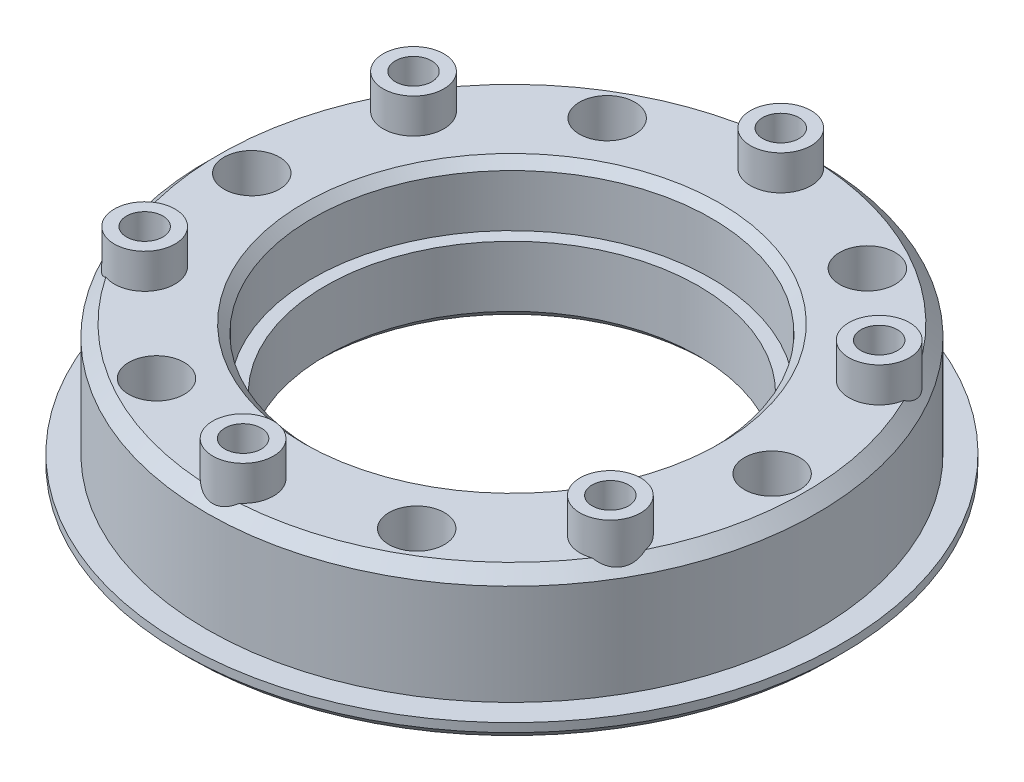
from build123d import *

# Parameters (mm, degrees)
SKETCH1_R                    = 19
BOSS_EXTRUDE1_DEPTH          = 1
SKETCH2_R                    = 17.575
BOSS_EXTRUDE2_DEPTH          = 6.5
SKETCH4_R                    = 10.75
CUT_EXTRUDE1_DEPTH           = 7.5
SKETCH5_R                    = 1.05
CUT_EXTRUDE2_DEPTH           = 3
CIRPATTERN1_COUNT            = 6
SKETCH6_R                    = 1.6
CUT_EXTRUDE3_DEPTH           = 7.5
CIRPATTERN2_COUNT            = 6
SKETCH7_R                    = 11.5
CUT_EXTRUDE4_DEPTH           = 3.5
CHAMFER1_SIZE                = 0.5
BOSS_EXTRUDE3_START          = 2
SKETCH8_R                    = 1.75
SKETCH8_R_2                  = 1.05
BOSS_EXTRUDE3_DEPTH          = 2
CIRPATTERN3_COUNT            = 6
CHAMFER2_SIZE                = 0.7
CUT_EXTRUDE5_DEPTH           = 3
FILLET1_R                    = 1
CHAMFER3_SIZE                = 0.5
CIRPATTERN4_COUNT            = 6
FILLET1_OF_CIRPATTERN4_R     = 1
CHAMFER3_OF_CIRPATTERN4_SIZE = 0.5


with BuildPart() as part:
    # Sketch1 → Boss-Extrude1 (new body)
    with BuildSketch(Plane(origin=(0, 0, 0), x_dir=(1, 0, 0), z_dir=(0, 1, 0))):
        with Locations(Location((0, 0, 0), (0, 0, 270))):
            Circle(SKETCH1_R)
    extrude(amount=BOSS_EXTRUDE1_DEPTH)

    # Sketch2 → Boss-Extrude2 (add)
    with BuildSketch(Plane(origin=(0, 1, 0), x_dir=(1, 0, 0), z_dir=(0, 1, 0))):
        with Locations(Location((0, 0, 0), (0, 0, 90))):
            Circle(SKETCH2_R)
    extrude(amount=BOSS_EXTRUDE2_DEPTH)

    # Sketch4 → Cut-Extrude1 (cut)
    with BuildSketch(Plane.XZ):
        with Locations(Location((0, 0, 0), (0, 0, 270))):
            Circle(SKETCH4_R)
    extrude(amount=-CUT_EXTRUDE1_DEPTH, mode=Mode.SUBTRACT)

    # Sketch5 → Cut-Extrude2 (cut)
    with BuildSketch(Plane(origin=(0, 7.5, 0), x_dir=(1, 0, 0), z_dir=(0, 1, 0))):
        with Locations(Location((0, 15.5, 0), (0, 0, 270))):
            Circle(SKETCH5_R)
    cut_extrude2 = extrude(amount=-CUT_EXTRUDE2_DEPTH, mode=Mode.SUBTRACT)

    # CirPattern1: Cut-Extrude2 ×6 about axis
    cirpattern1_axis = Axis((0, 0, 0), (0, 1, 0))
    for i in range(1, CIRPATTERN1_COUNT):
        add(cut_extrude2.rotate(cirpattern1_axis, i * 360 / CIRPATTERN1_COUNT), mode=Mode.SUBTRACT)

    # Sketch6 → Cut-Extrude3 (cut)
    with BuildSketch(Plane(origin=(0, 7.5, 0), x_dir=(1, 0, 0), z_dir=(0, 1, 0))):
        with Locations(Location((7.5, 12.990381057, 0), (0, 0, 270))):
            Circle(SKETCH6_R)
    cut_extrude3 = extrude(amount=-CUT_EXTRUDE3_DEPTH, mode=Mode.SUBTRACT)

    # CirPattern2: Cut-Extrude3 ×6 about axis
    cirpattern2_axis = Axis((0, 0, 0), (0, 1, 0))
    for i in range(1, CIRPATTERN2_COUNT):
        add(cut_extrude3.rotate(cirpattern2_axis, i * 360 / CIRPATTERN2_COUNT), mode=Mode.SUBTRACT)

    # Sketch7 → Cut-Extrude4 (cut)
    with BuildSketch(Plane(origin=(0, 7.5, 0), x_dir=(1, 0, 0), z_dir=(0, 1, 0))):
        with Locations(Location((0, 0, 0), (0, 0, 270))):
            Circle(SKETCH7_R)
    extrude(amount=-CUT_EXTRUDE4_DEPTH, mode=Mode.SUBTRACT)

    # Chamfer1
    chamfer1_edges = [part.edges().sort_by_distance(p)[0] for p in [
        (0, 0, 10.75),
        (0, 0, -19),
        (0, 7.5, -11.5),
    ]]
    chamfer(chamfer1_edges, length=CHAMFER1_SIZE)

    # Sketch8 → Boss-Extrude3 (add)
    with BuildSketch(Plane(origin=(0, 7.5, 0), x_dir=(1, 0, 0), z_dir=(0, 1, 0)).offset(BOSS_EXTRUDE3_START)):
        with Locations(Location((0, 15.5, 0), (0, 0, 270))):
            Circle(SKETCH8_R)
        with Locations(Location((0, 15.5, 0), (0, 0, 270))):
            Circle(SKETCH8_R_2, mode=Mode.SUBTRACT)
    boss_extrude3 = extrude(amount=-BOSS_EXTRUDE3_DEPTH)

    # CirPattern3: Boss-Extrude3 ×6 about axis
    cirpattern3_axis = Axis((0, 0, 0), (0, 1, 0))
    for i in range(1, CIRPATTERN3_COUNT):
        add(boss_extrude3.rotate(cirpattern3_axis, i * 360 / CIRPATTERN3_COUNT))

    # Chamfer2
    # the kernel refuses this chamfer: 0.7 mm, written as the material it takes off along each edge
    with BuildSketch(Plane(origin=(0, 7.5, 0), x_dir=(0, 0, -1), z_dir=(1, 0, 0))) as chamfer2_piece_1_section:
        Polygon((17.575, -CHAMFER2_SIZE), (17.575 - CHAMFER2_SIZE, 0), (17.575, 0), align=None)
    chamfer2_piece_1 = revolve(axis=Axis((0, 7.5, 0), (0, 1, 0)), mode=Mode.PRIVATE)
    chamfer2_piece_1 = chamfer2_piece_1 - Plane(origin=(0, 6.925133539, 15.5), x_dir=(0, 0, -1), z_dir=(0, 1, 0)) * Cylinder(1.75, 71, mode=Mode.PRIVATE)
    chamfer2_piece_1 = chamfer2_piece_1 - Plane(origin=(-13.423393759, 6.925133539, 7.75), x_dir=(0.8660254037844388, 0, -0.4999999999999996), z_dir=(0, 1, 0)) * Cylinder(1.75, 71, mode=Mode.PRIVATE)
    chamfer2_piece_1 = chamfer2_piece_1 - Plane(origin=(13.423393759, 6.925133539, 7.75), x_dir=(-0.8660254037844384, 0, -0.5000000000000007), z_dir=(0, 1, 0)) * Cylinder(1.75, 71, mode=Mode.PRIVATE)
    chamfer2_piece_1 = chamfer2_piece_1 - Plane(origin=(-13.423393759, 6.925133539, -7.75), x_dir=(0.8660254037844386, 0, 0.5000000000000003), z_dir=(0, 1, 0)) * Cylinder(1.75, 71, mode=Mode.PRIVATE)
    chamfer2_piece_1 = chamfer2_piece_1 - Plane(origin=(13.423393759, 6.925133539, -7.75), x_dir=(-0.8660254037844387, 0, 0.49999999999999994), z_dir=(0, 1, 0)) * Cylinder(1.75, 71, mode=Mode.PRIVATE)
    chamfer2_piece_1 = chamfer2_piece_1 - Plane(origin=(0, 6.925133539, -15.5), x_dir=(0, 0, 1), z_dir=(0, 1, 0)) * Cylinder(1.75, 71, mode=Mode.PRIVATE)
    add(chamfer2_piece_1, mode=Mode.SUBTRACT)

    # Sketch9 → Cut-Extrude5 (cut)
    with BuildSketch(Plane.XZ):
        with BuildLine():
            Line((-3.931230803, 15.767305552), (-3.024023695, 12.128696578))
            ThreePointArc((-3.024023695, 12.128696578), (0, 12.5), (3.024023695, 12.128696578))
            Line((3.024023695, 12.128696578), (3.931230803, 15.767305552))
            ThreePointArc((3.931230803, 15.767305552), (0, 16.25), (-3.931230803, 15.767305552))
        make_face()
    cut_extrude5 = extrude(amount=-CUT_EXTRUDE5_DEPTH, mode=Mode.SUBTRACT)

    # Fillet1
    fillet1_edges = [part.edges().sort_by_distance(p)[0] for p in [
        (-3.931230803, 1.5, 15.767305552),
        (3.931230803, 1.5, 15.767305552),
        (3.024023695, 1.5, 12.128696578),
        (-3.024023695, 1.5, 12.128696578),
    ]]
    fillet(fillet1_edges, radius=FILLET1_R)

    # Chamfer3
    chamfer3_edges = [part.edges().sort_by_distance(p)[0] for p in [
        (-3.469170847, 0, 13.914084287),
        (0, 0, 16.25),
        (0, 0, 12.5),
        (3.469170847, 0, 13.914084287),
        (-3.550883145, 0, 15.549964329),
        (-2.833130451, 0, 12.467438105),
        (2.833130451, 0, 12.467438105),
        (3.550883145, 0, 15.549964329),
    ]]
    chamfer(chamfer3_edges, length=CHAMFER3_SIZE)

    # CirPattern4: Cut-Extrude5 ×6 about axis
    cirpattern4_axis = Axis((0, 0, 0), (0, 1, 0))
    for i in range(1, CIRPATTERN4_COUNT):
        add(cut_extrude5.rotate(cirpattern4_axis, i * 360 / CIRPATTERN4_COUNT), mode=Mode.SUBTRACT)

    # Fillet1 of CirPattern4
    fillet1_of_cirpattern4_edges = [part.edges().sort_by_distance(p)[0] for p in [
        (11.689271756, 1.5, 11.28819852),
        (15.620502559, 1.5, 4.479107032),
        (12.015771199, 1.5, 3.445466948),
        (8.991747504, 1.5, 8.683229631),
        (15.620502559, 1.5, -4.479107032),
        (11.689271756, 1.5, -11.28819852),
        (8.991747504, 1.5, -8.683229631),
        (12.015771199, 1.5, -3.445466948),
        (3.931230803, 1.5, -15.767305552),
        (-3.931230803, 1.5, -15.767305552),
        (-3.024023695, 1.5, -12.128696578),
        (3.024023695, 1.5, -12.128696578),
        (-11.689271756, 1.5, -11.28819852),
        (-15.620502559, 1.5, -4.479107032),
        (-12.015771199, 1.5, -3.445466948),
        (-8.991747504, 1.5, -8.683229631),
        (-15.620502559, 1.5, 4.479107032),
        (-11.689271756, 1.5, 11.28819852),
        (-8.991747504, 1.5, 8.683229631),
        (-12.015771199, 1.5, 3.445466948),
    ]]
    fillet(fillet1_of_cirpattern4_edges, radius=FILLET1_OF_CIRPATTERN4_R)

    # Chamfer3 of CirPattern4
    chamfer3_of_cirpattern4_edges = [part.edges().sort_by_distance(p)[0] for p in [
        (10.315365039, 0, 9.961432226),
        (14.072912811, 0, 8.125),
        (10.825317547, 0, 6.25),
        (13.784535886, 0, 3.95265206),
        (11.691222564, 0, 10.850137174),
        (9.380552894, 0, 8.687281995),
        (12.213683345, 0, 3.78015611),
        (15.242105709, 0, 4.699827155),
        (13.784535886, 0, -3.95265206),
        (14.072912811, 0, -8.125),
        (10.825317547, 0, -6.25),
        (10.315365039, 0, -9.961432226),
        (15.242105709, 0, -4.699827155),
        (12.213683345, 0, -3.78015611),
        (9.380552894, 0, -8.687281995),
        (11.691222564, 0, -10.850137174),
        (3.469170847, 0, -13.914084287),
        (0, 0, -16.25),
        (0, 0, -12.5),
        (-3.469170847, 0, -13.914084287),
        (3.550883145, 0, -15.549964329),
        (2.833130451, 0, -12.467438105),
        (-2.833130451, 0, -12.467438105),
        (-3.550883145, 0, -15.549964329),
        (-10.315365039, 0, -9.961432226),
        (-14.072912811, 0, -8.125),
        (-10.825317547, 0, -6.25),
        (-13.784535886, 0, -3.95265206),
        (-11.691222564, 0, -10.850137174),
        (-9.380552894, 0, -8.687281995),
        (-12.213683345, 0, -3.78015611),
        (-15.242105709, 0, -4.699827155),
        (-13.784535886, 0, 3.95265206),
        (-14.072912811, 0, 8.125),
        (-10.825317547, 0, 6.25),
        (-10.315365039, 0, 9.961432226),
        (-15.242105709, 0, 4.699827155),
        (-12.213683345, 0, 3.78015611),
        (-9.380552894, 0, 8.687281995),
        (-11.691222564, 0, 10.850137174),
    ]]
    chamfer(chamfer3_of_cirpattern4_edges, length=CHAMFER3_OF_CIRPATTERN4_SIZE)


solid = part.part
